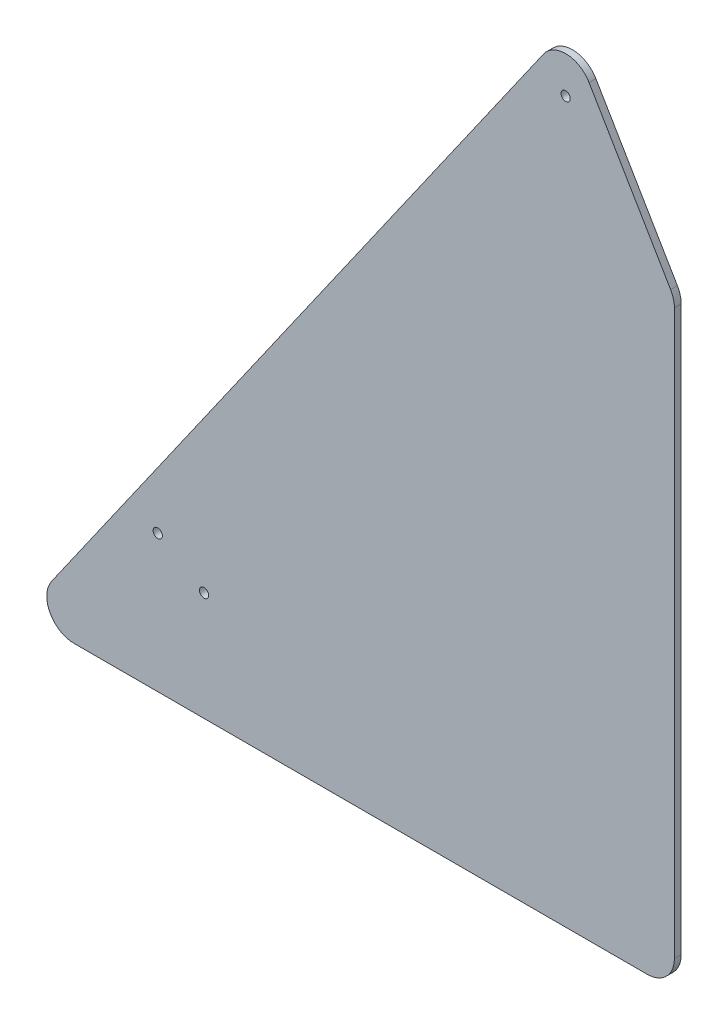
from build123d import *

# Parameters (mm, degrees)
BOSS_EXTRUDE1_DEPTH = 3.175
SKETCH2_R           = 2.159
CUT_EXTRUDE1_DEPTH  = 475.859409022
FILLET1_R           = 12.7


with BuildPart() as part:
    # Sketch1 → Boss-Extrude1 (new body)
    with BuildSketch(Plane.XY):
        Polygon((0, 0), (304.8, 0), (304.8, 279.4), (254.954725958, 364.113083686), align=None)
    extrude(amount=BOSS_EXTRUDE1_DEPTH)

    # Sketch2 → Cut-Extrude1 (cut, through all)
    with BuildSketch(Plane.XY.offset(3.175)):
        with Locations((63.5, 64.117269263)):
            Circle(SKETCH2_R)
        with Locations((254, 336.179464547)):
            Circle(SKETCH2_R)
        with Locations((85.128923676, 50.8)):
            Circle(SKETCH2_R)
    extrude(amount=-CUT_EXTRUDE1_DEPTH, mode=Mode.SUBTRACT)

    # Fillet1
    fillet1_edges = [part.edges().sort_by_distance(p)[0] for p in [
        (0, 0, 1.5875),
        (304.8, 0, 1.5875),
        (304.8, 279.4, 1.5875),
        (254.954725958, 364.113083686, 1.5875),
    ]]
    fillet(fillet1_edges, radius=FILLET1_R)


solid = part.part
